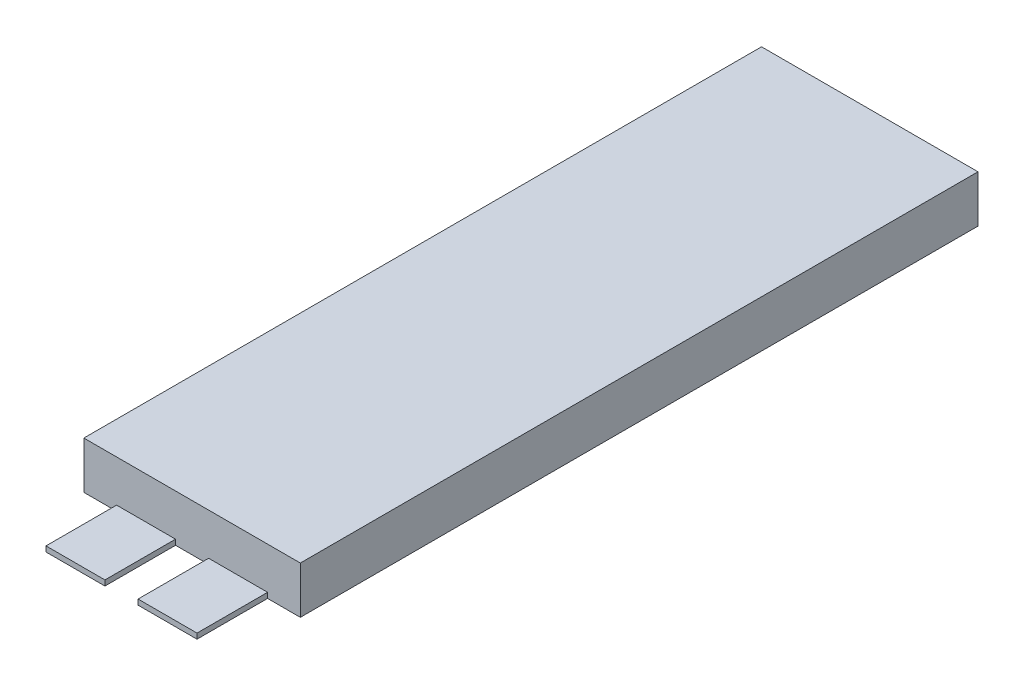
from build123d import *

# Parameters (mm, degrees)
SKETCH1_W           = 46
SKETCH1_H           = 144
CELL_DEPTH          = 10
SKETCH2_W           = 12.525135801
SKETCH2_H           = 1.132917149
BOSS_EXTRUDE1_DEPTH = 15


with BuildPart() as part:
    # Sketch1 → cell (new body)
    with BuildSketch(Plane(origin=(0, 0, 0), x_dir=(1, 0, 0), z_dir=(0, 1, 0))):
        Rectangle(SKETCH1_W, SKETCH1_H)
    extrude(amount=CELL_DEPTH)

    # Sketch2 → Boss-Extrude1 (add)
    with BuildSketch(Plane.XY.offset(72)):
        with Locations((-9.780847428, 0.566458575)):
            Rectangle(SKETCH2_W, SKETCH2_H)
        with Locations((9.780847428, 0.566458575)):
            Rectangle(SKETCH2_W, SKETCH2_H)
    extrude(amount=BOSS_EXTRUDE1_DEPTH)


solid = part.part
